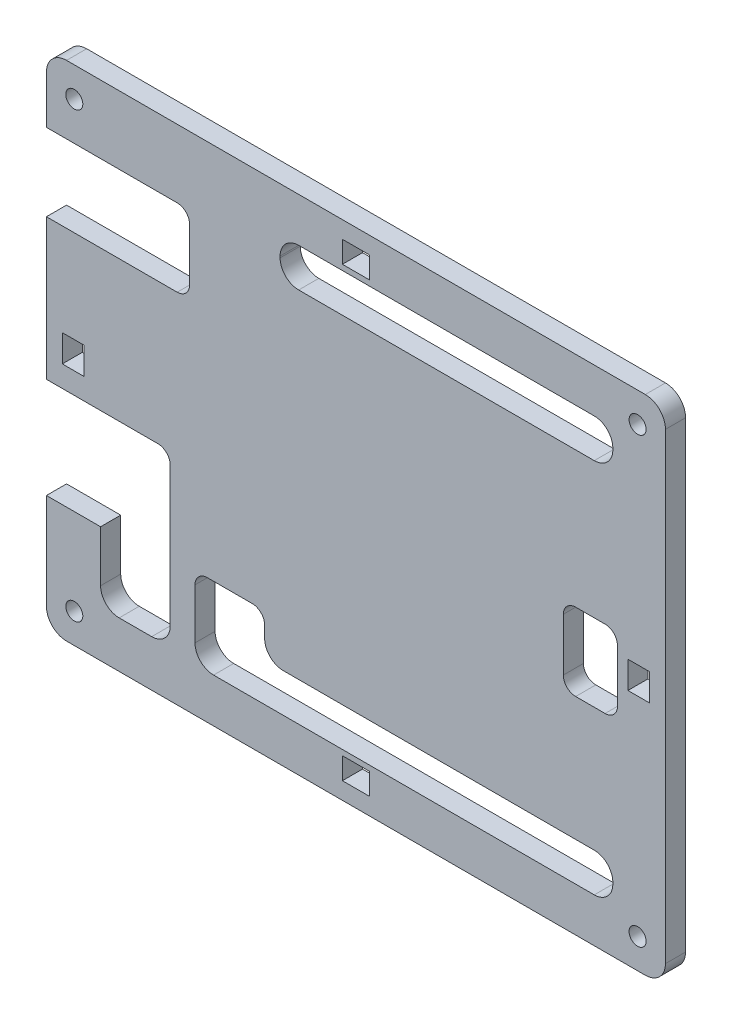
from build123d import *

# Parameters (mm, degrees)
SKETCH1_W          = 80
SKETCH1_H          = 65
BASE_FLANGE1_DEPTH = 2.6
SKETCH6_R          = 1.0999978
CUT_EXTRUDE1_DEPTH = 10
FILLET1_R          = 2.6
SKETCH7_W          = 18.5
SKETCH7_H          = 10
SKETCH7_W_2        = 43
SKETCH7_H_2        = 5
SKETCH7_W_3        = 7
CUT_EXTRUDE2_DEPTH = 2.6
FILLET2_R          = 2.4
FILLET3_R          = 1.6
SKETCH11_W         = 3.5
SKETCH11_H         = 2.8
SKETCH11_W_2       = 2.8
SKETCH11_H_2       = 3.5
CUT_EXTRUDE5_DEPTH = 10


# Sheet-metal steps are written as plain solids
with BuildPart() as part:
    # Sketch1 → Base-Flange1 (new body)
    with BuildSketch(Plane.XY):
        Rectangle(SKETCH1_W, SKETCH1_H)
    extrude(amount=-BASE_FLANGE1_DEPTH)

    # Sketch6 → Cut-Extrude1 (cut)
    with BuildSketch(Plane.XY):
        with Locations((-36.4, 28.65)):
            Circle(SKETCH6_R)
        with Locations(Location((-36.4, -28.65, 0), (0, 0, 180))):
            Circle(SKETCH6_R)
        with Locations((36.4, -28.65)):
            Circle(SKETCH6_R)
        with Locations(Location((36.4, 28.65, 0), (0, 0, 180))):
            Circle(SKETCH6_R)
    extrude(amount=-CUT_EXTRUDE1_DEPTH, mode=Mode.SUBTRACT)

    # Fillet1
    fillet1_edges = [part.edges().sort_by_distance(p)[0] for p in [
        (-40, 32.5, -1.3),
        (40, 32.5, -1.3),
        (40, -32.5, -1.3),
        (-40, -32.5, -1.3),
    ]]
    fillet(fillet1_edges, radius=FILLET1_R)

    # Sketch7 → Cut-Extrude2 (cut)
    with BuildSketch(Plane.XY):
        with Locations((-30.75, 18.7)):
            Rectangle(SKETCH7_W, SKETCH7_H)
        Polygon((-40, -4.5), (-24, -4.5), (-24, -26.5), (-33, -26.5), (-33, -17.5), (-40, -17.5), align=None)
        with Locations((11.7, 24.3)):
            Rectangle(SKETCH7_W_2, SKETCH7_H_2)
        Polygon((-11.8, -21.8), (-11.8, -16.3), (-20.8, -16.3), (-20.8, -26.8), (33.2, -26.8), (33.2, -21.8), align=None)
        with Locations((30.3, -0.8)):
            Rectangle(SKETCH7_W_3, SKETCH7_H)
    extrude(amount=-CUT_EXTRUDE2_DEPTH, mode=Mode.SUBTRACT)

    # Fillet2
    fillet2_edges = [part.edges().sort_by_distance(p)[0] for p in [
        (-9.8, 21.8, -1.3),
        (-9.8, 26.8, -1.3),
        (33.2, 26.8, -1.3),
        (33.2, 21.8, -1.3),
        (33.2, -21.8, -1.3),
        (33.2, -26.8, -1.3),
        (-20.8, -26.8, -1.3),
        (-11.8, -21.8, -1.3),
        (-24, -26.5, -1.3),
        (-33, -26.5, -1.3),
    ]]
    fillet(fillet2_edges, radius=FILLET2_R)

    # Fillet3
    fillet3_edges = [part.edges().sort_by_distance(p)[0] for p in [
        (26.8, -5.8, -1.3),
        (26.8, 4.2, -1.3),
        (33.8, 4.2, -1.3),
        (33.8, -5.8, -1.3),
        (-20.8, -16.3, -1.3),
        (-11.8, -16.3, -1.3),
        (-21.5, 23.7, -1.3),
        (-21.5, 13.7, -1.3),
        (-24, -4.5, -1.3),
    ]]
    fillet(fillet3_edges, radius=FILLET3_R)

    # Sketch11 → Cut-Extrude5 (cut)
    with BuildSketch(Plane.XY):
        with Locations((0, 28.9)):
            Rectangle(SKETCH11_W, SKETCH11_H)
        with Locations((36.55, 0)):
            Rectangle(SKETCH11_W_2, SKETCH11_H_2)
        with Locations((0, -28.9)):
            Rectangle(SKETCH11_W, SKETCH11_H)
        with Locations((-36.55, 0)):
            Rectangle(SKETCH11_W_2, SKETCH11_H_2)
    extrude(amount=-CUT_EXTRUDE5_DEPTH, mode=Mode.SUBTRACT)


solid = part.part
